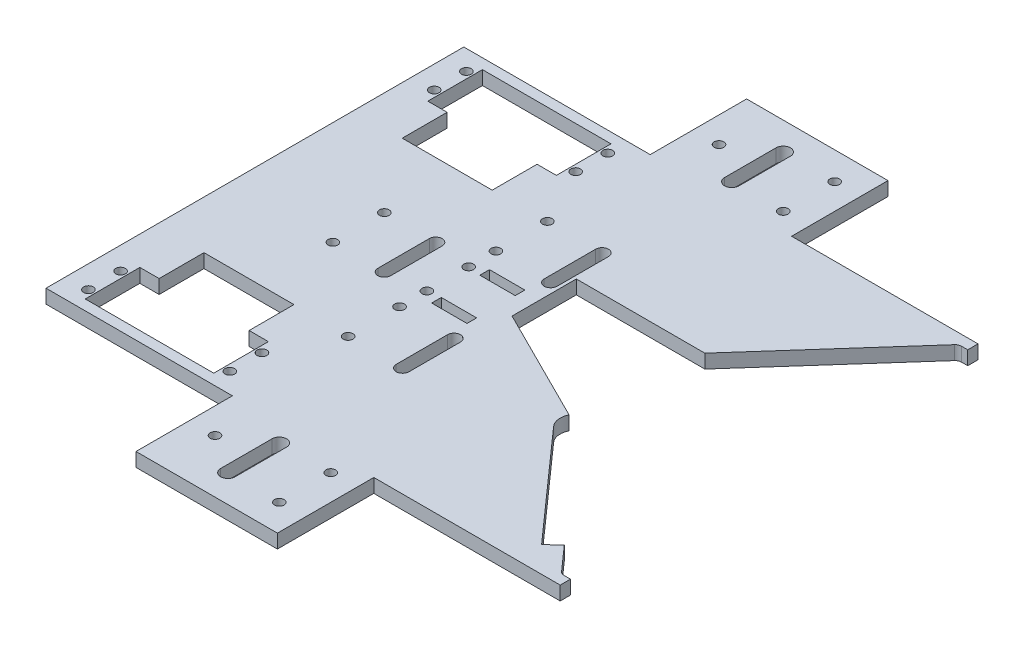
from build123d import *

# Parameters (mm, degrees)
BOSS_EXTRUDE1_DEPTH = 4.3
CUT_EXTRUDE1_DEPTH  = 4.5
FILLET1_R           = 2
CUT_EXTRUDE2_DEPTH  = 10
SKETCH8_R           = 1.5
CUT_EXTRUDE3_DEPTH  = 10
SKETCH9_R           = 1.5
CUT_EXTRUDE4_DEPTH  = 10
CUT_EXTRUDE5_DEPTH  = 10
SKETCH11_R          = 1.5
CUT_EXTRUDE6_DEPTH  = 10
SKETCH12_R          = 1.5
CUT_EXTRUDE7_DEPTH  = 10
SKETCH7_R           = 1.5
SKETCH7_W           = 11
SKETCH7_H           = 3
CUT_EXTRUDE8_DEPTH  = 9


with BuildPart() as part:
    # Sketch2 → Boss-Extrude1 (new body)
    with BuildSketch(Plane(origin=(0, 0, 0), x_dir=(1, 0, 0), z_dir=(0, 1, 0))):
        Polygon((0, 0), (0, 65), (58, 65), (58, 95), (102, 95), (102, 65), (160, 65), (160, 0), align=None)
    extrude(amount=BOSS_EXTRUDE1_DEPTH)

    # Mirror1: part across plane


with BuildPart() as part_1:
    add(part.part)
    add(part.part.mirror(Plane(origin=(0, 4.3, 0), x_dir=(1, 0, 0), z_dir=(0, 0, -1))))

    # Sketch3 → Cut-Extrude1 (cut)
    with BuildSketch(Plane(origin=(0, 4.3, 0), x_dir=(1, 0, 0), z_dir=(0, 1, 0))):
        Polygon((160, -61.8), (160, 61.8), (157.156451185, 61.8), (120.012594795, 20), (80.012594795, 20), (80.012594795, 0), (120, -20), (157.155555556, -61.8), align=None)
    extrude(amount=-CUT_EXTRUDE1_DEPTH, mode=Mode.SUBTRACT)

    # Fillet1
    fillet1_edges = [part_1.edges().sort_by_distance(p)[0] for p in [
        (157.156451185, 2.15, -61.8),
        (157.155555556, 2.15, 61.8),
    ]]
    fillet(fillet1_edges, radius=FILLET1_R)

    # Sketch6 → Cut-Extrude2 (cut)
    with BuildSketch(Plane(origin=(0, 4.3, 0), x_dir=(1, 0, 0), z_dir=(0, 1, 0))):
        Polygon((9, -61.8), (49, -61.8), (49, -44.8), (43, -44.8), (43, -30.841820122), (15, -30.841820122), (15, -44.8), (9, -44.8), align=None)
        Polygon((9, 44.8), (15, 44.8), (15, 30.841820122), (43, 30.841820122), (43, 44.8), (49, 44.8), (49, 61.8), (9, 61.8), align=None)
    extrude(amount=-CUT_EXTRUDE2_DEPTH, mode=Mode.SUBTRACT)

    # Sketch8 → Cut-Extrude3 (cut)
    with BuildSketch(Plane(origin=(0, 4.3, 0), x_dir=(1, 0, 0), z_dir=(0, 1, 0))):
        with Locations((7, 58.8)):
            Circle(SKETCH8_R)
        with Locations((7, 48.8)):
            Circle(SKETCH8_R)
        with Locations((51, 48.8)):
            Circle(SKETCH8_R)
        with Locations((51, 58.8)):
            Circle(SKETCH8_R)
        with Locations((7, -48.8)):
            Circle(SKETCH8_R)
        with Locations((7, -58.8)):
            Circle(SKETCH8_R)
        with Locations((51, -58.8)):
            Circle(SKETCH8_R)
        with Locations((51, -48.8)):
            Circle(SKETCH8_R)
    extrude(amount=-CUT_EXTRUDE3_DEPTH, mode=Mode.SUBTRACT)

    # Sketch9 → Cut-Extrude4 (cut)
    with BuildSketch(Plane.XZ):
        with Locations((94, 70.4)):
            Circle(SKETCH9_R)
        with Locations((66, 78.4)):
            Circle(SKETCH9_R)
        with Locations((66, -78.4)):
            Circle(SKETCH9_R)
        with Locations((94, -86.4)):
            Circle(SKETCH9_R)
        with Locations((94, 86.4)):
            Circle(SKETCH9_R)
        with Locations((94, -70.4)):
            Circle(SKETCH9_R)
        with BuildLine():
            Line((75.75, 70.4), (75.75, 86.4))
            ThreePointArc((75.75, 86.4), (78, 88.65), (80.25, 86.4))
            Line((80.25, 86.4), (80.25, 70.4))
            ThreePointArc((80.25, 70.4), (78, 68.15), (75.75, 70.4))
        make_face()
        with BuildLine():
            Line((75.75, -86.4), (75.75, -70.4))
            ThreePointArc((75.75, -70.4), (78, -68.15), (80.25, -70.4))
            Line((80.25, -70.4), (80.25, -86.4))
            ThreePointArc((80.25, -86.4), (78, -88.65), (75.75, -86.4))
        make_face()
    extrude(amount=-CUT_EXTRUDE4_DEPTH, mode=Mode.SUBTRACT)

    # Sketch10 → Cut-Extrude5 (cut)
    with BuildSketch(Plane(origin=(0, 4.3, 0), x_dir=(1, 0, 0), z_dir=(0, 1, 0))):
        with BuildLine():
            Line((123.321819194, -23.737046593), (149.896372747, -53.633419341))
            Line((149.896372747, -53.633419341), (146.159326154, -56.955238535))
            Line((146.159326154, -56.955238535), (116.262953407, -23.321819194))
            ThreePointArc((116.262953407, -23.321819194), (120.29361011, -15.008628134), (123.321819194, -23.737046593))
        make_face()
    extrude(amount=-CUT_EXTRUDE5_DEPTH, mode=Mode.SUBTRACT)

    # Sketch11 → Cut-Extrude6 (cut)
    with BuildSketch(Plane.XZ):
        with BuildLine():
            ThreePointArc((79, 31.031280577), (77, 33.031280577), (75, 31.031280577))
            Line((75, 31.031280577), (75, 15.031280577))
            ThreePointArc((75, 15.031280577), (77, 13.031280577), (79, 15.031280577))
            Line((79, 15.031280577), (79, 31.031280577))
        make_face()
        with BuildLine():
            ThreePointArc((75, -31.031280577), (77, -33.031280577), (79, -31.031280577))
            Line((79, -31.031280577), (79, -15.031280577))
            ThreePointArc((79, -15.031280577), (77, -13.031280577), (75, -15.031280577))
            Line((75, -15.031280577), (75, -31.031280577))
        make_face()
        with Locations((60, 31)):
            Circle(SKETCH11_R)
        with Locations((60, 15)):
            Circle(SKETCH11_R)
        with Locations((60, -15)):
            Circle(SKETCH11_R)
        with Locations((60, -31)):
            Circle(SKETCH11_R)
    extrude(amount=-CUT_EXTRUDE6_DEPTH, mode=Mode.SUBTRACT)

    # Sketch12 → Cut-Extrude7 (cut)
    with BuildSketch(Plane(origin=(0, 0, 0), x_dir=(-1, 0, 0), z_dir=(0, -1, 0))):
        with BuildLine():
            ThreePointArc((-50.262723036, -8), (-48.262723036, -10), (-46.262723036, -8))
            Line((-46.262723036, -8), (-46.262723036, 8))
            ThreePointArc((-46.262723036, 8), (-48.262723036, 10), (-50.262723036, 8))
            Line((-50.262723036, 8), (-50.262723036, -8))
        make_face()
        with Locations((-32.262723036, -8)):
            Circle(SKETCH12_R)
        with Locations((-32.262723036, 8)):
            Circle(SKETCH12_R)
    extrude(amount=-CUT_EXTRUDE7_DEPTH, mode=Mode.SUBTRACT)

    # Sketch7 → Cut-Extrude8 (cut)
    with BuildSketch(Plane(origin=(0, 4.3, 0), x_dir=(1, 0, 0), z_dir=(0, 1, 0))):
        with Locations((60.012594795, -6.5)):
            Circle(SKETCH7_R)
        with Locations((60.012594795, 6.5)):
            Circle(SKETCH7_R)
        with Locations((69.5, -7.5)):
            Rectangle(SKETCH7_W, SKETCH7_H)
        with Locations((69.5, 7.5)):
            Rectangle(SKETCH7_W, SKETCH7_H)
    extrude(amount=-CUT_EXTRUDE8_DEPTH, mode=Mode.SUBTRACT)


solid = part_1.part
